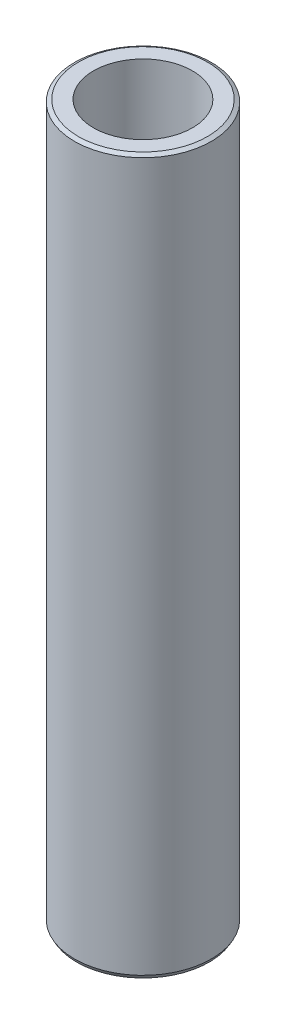
from build123d import *
from OCP.BRepFilletAPI import BRepFilletAPI_MakeChamfer

# Parameters (mm, degrees)
SKETCH1_R           = 57.5
BOSS_EXTRUDE1_DEPTH = 600
SKETCH2_R           = 41.554028488
CUT_EXTRUDE1_DEPTH  = 606.485342515
CHAMFER1_SIZE       = 1.858382285
CHAMFER1_SIZE2      = 3.273371271


with BuildPart() as part:
    # Sketch1 → Boss-Extrude1 (new body)
    with BuildSketch(Plane(origin=(0, 0, 0), x_dir=(1, 0, 0), z_dir=(0, 1, 0))):
        Circle(SKETCH1_R)
    extrude(amount=BOSS_EXTRUDE1_DEPTH)

    # Sketch2 → Cut-Extrude1 (cut, through all)
    with BuildSketch(Plane(origin=(0, 0, 0), x_dir=(1, 0, 0), z_dir=(0, 1, 0))):
        Circle(SKETCH2_R)
    extrude(amount=CUT_EXTRUDE1_DEPTH, mode=Mode.SUBTRACT)

    # Chamfer1: one chamfer whose edges measure the first distance from different faces: ONE call of the kernel's chamfer builder (chamfer() names one face for all edges)
    chamfer1_edges_1 = [part.edges().sort_by_distance(p)[0] for p in [
        (-57.5, 600, 0),
    ]]
    chamfer1_side_1 = [part.faces().sort_by_distance(p)[0] for p in [
        (-57.5, 300, 0),
    ]]
    chamfer1_edges_2 = [part.edges().sort_by_distance(p)[0] for p in [
        (-57.5, 0, 0),
    ]]
    chamfer1_side_2 = [part.faces().sort_by_distance(p)[0] for p in [
        (-55.873654403, 0, 0),
    ]]
    chamfer1 = BRepFilletAPI_MakeChamfer(part.part.solid().wrapped)
    for e in chamfer1_edges_1:
        chamfer1.Add(CHAMFER1_SIZE, CHAMFER1_SIZE2, e.wrapped, chamfer1_side_1[0].wrapped)  # the first distance lies on this face
    for e in chamfer1_edges_2:
        chamfer1.Add(CHAMFER1_SIZE, CHAMFER1_SIZE2, e.wrapped, chamfer1_side_2[0].wrapped)  # the first distance lies on this face
    add(Compound.cast(chamfer1.Shape()), mode=Mode.REPLACE)


solid = part.part
